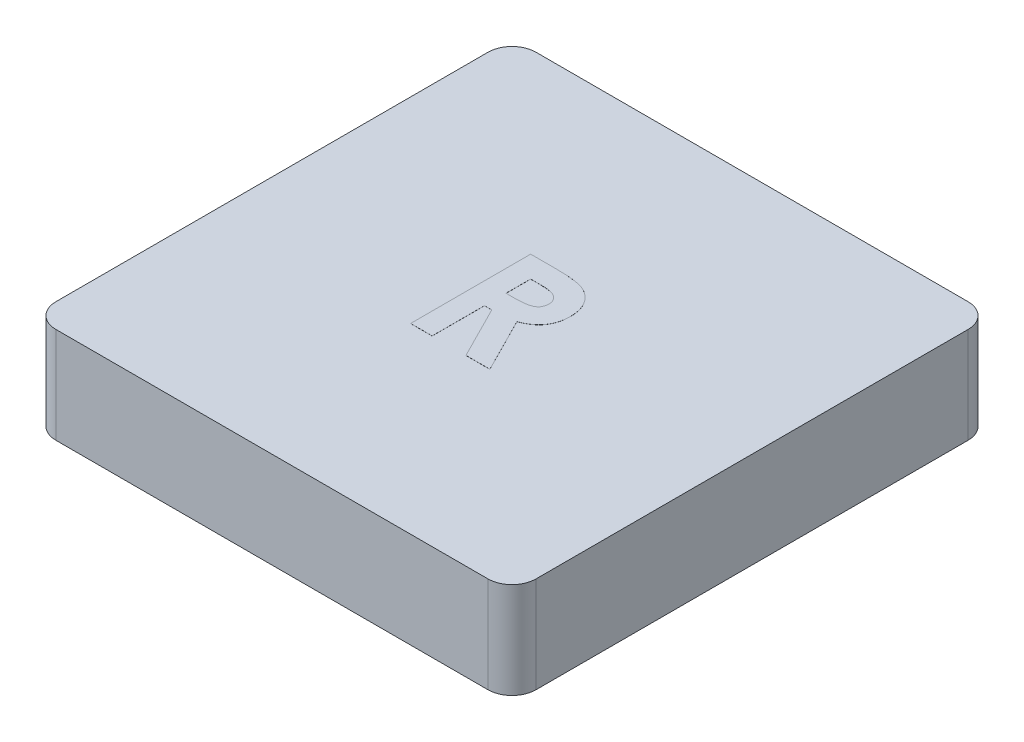
from build123d import *

# Parameters (mm, degrees)
SKETCH1_W           = 12.7
SKETCH1_H           = 12.7
BOSS_EXTRUDE1_DEPTH = 2.54
FILLET1_R           = 0.635
SHELL1_START        = 0.635
SHELL1_OUTLINE_W    = 1.905
SHELL1_OUTLINE_H    = 11.43
SHELL1_DEPTH        = 11.43
SKETCH2_R           = 2.54
BOSS_EXTRUDE2_DEPTH = 1.905
BOSS_EXTRUDE3_DEPTH = 0.00254


# Read off the part's stored shape, not the designer's step: Shell1
with BuildPart() as part:
    # Sketch1 → Boss-Extrude1 (new body)
    with BuildSketch(Plane(origin=(0, 0, 0), x_dir=(1, 0, 0), z_dir=(0, 1, 0))):
        with Locations((6.35, 6.35)):
            Rectangle(SKETCH1_W, SKETCH1_H)
    extrude(amount=BOSS_EXTRUDE1_DEPTH)

    # Fillet1
    fillet1_edges = [part.edges().sort_by_distance(p)[0] for p in [
        (0, 1.27, -12.7),
        (12.7, 1.27, -12.7),
        (12.7, 1.27, 0),
        (0, 1.27, 0),
    ]]
    fillet(fillet1_edges, radius=FILLET1_R)

    # Shell1 outline → Shell1 (cut)
    with BuildSketch(Plane.YZ.offset(SHELL1_START)):
        with Locations((0.9525, -6.35)):
            Rectangle(SHELL1_OUTLINE_W, SHELL1_OUTLINE_H)
    extrude(amount=SHELL1_DEPTH, mode=Mode.SUBTRACT)

    # Sketch2 → Boss-Extrude2 (add)
    with BuildSketch(Plane(origin=(0, 1.905, 0), x_dir=(-1, 0, 0), z_dir=(0, -1, 0))):
        with Locations(Location((-6.35, 6.35, 0), (0, 0, 270))):
            Circle(SKETCH2_R)
    extrude(amount=BOSS_EXTRUDE2_DEPTH)

    # Sketch3 → Boss-Extrude3 (add)
    with BuildSketch(Plane(origin=(0, 2.54, 0), x_dir=(1, 0, 0), z_dir=(0, 1, 0))):
        with BuildLine():
            Line((5.192346154, 8.001), (5.856348558, 8.001))
            add(Edge.make_bspline(
                [(5.856348558, 8.001), (5.900238914, 8.000844214), (5.984652434, 8.000544595), (6.106372118, 7.995817392), (6.218188387, 7.989239101), (6.320266796, 7.979200455), (6.412563672, 7.965890424), (6.49517152, 7.950200099), (6.568087924, 7.93231761), (6.631927834, 7.910034619), (6.689540196, 7.884899742), (6.743242928, 7.856019307), (6.79422079, 7.823714908), (6.842133051, 7.787136528), (6.887396081, 7.746942202), (6.93009527, 7.703091473), (6.969627239, 7.655212502), (7.005747205, 7.603607826), (7.038667646, 7.54932089), (7.067762412, 7.492277157), (7.091422324, 7.432436959), (7.112328392, 7.370665114), (7.127386356, 7.306078583), (7.13785895, 7.239306125), (7.145526573, 7.170112696), (7.145967424, 7.123105753), (7.146192308, 7.099127003)],
                knots=[0, 0, 0, 0, 1.749336639, 3.364467119, 4.854658419, 6.213483162, 7.451590619, 8.570285859, 9.5643256, 10.440900261, 11.26203566, 12.067320669, 12.869050712, 13.665104639, 14.467235401, 15.27997916, 16.102287765, 16.939272006, 17.78853747, 18.631303466, 19.488103222, 20.351255419, 21.228522269, 22.127379805, 23.044756219, 24, 24, 24, 24], degree=3))
            add(Edge.make_bspline(
                [(7.146192308, 7.099127003), (7.145608142, 7.074098697), (7.1444627, 7.025022751), (7.138292723, 6.952934188), (7.127015945, 6.883964894), (7.109935624, 6.818316801), (7.090304013, 6.755172843), (7.064199007, 6.695698066), (7.034736927, 6.639027495), (6.999745675, 6.585962756), (6.961344486, 6.535325176), (6.916684711, 6.489054868), (6.868659617, 6.444664978), (6.814569539, 6.404935939), (6.756798818, 6.367181417), (6.694199611, 6.332965765), (6.627180461, 6.301428881), (6.580062679, 6.283841737), (6.555967949, 6.274848157)],
                knots=[0, 0, 0, 0, 1.099860209, 2.156625411, 3.176576793, 4.16617041, 5.135385252, 6.078461593, 7.016046972, 7.938469504, 8.868247731, 9.803980173, 10.76021508, 11.73834243, 12.748633912, 13.790971185, 14.870363756, 16, 16, 16, 16], degree=3))
            Line((6.555967949, 6.274848157), (7.288660256, 4.826))
            Line((7.288660256, 4.826), (6.655186699, 4.826))
            Line((6.655186699, 4.826), (5.955567308, 6.209974359))
            Line((5.955567308, 6.209974359), (5.762217949, 6.209974359))
            Line((5.762217949, 6.209974359), (5.762217949, 4.826))
            Line((5.762217949, 4.826), (5.192346154, 4.826))
            Line((5.192346154, 4.826), (5.192346154, 8.001))
        make_face()
        with BuildLine():
            Line((5.762217949, 6.779846154), (5.984188101, 6.779846154))
            add(Edge.make_bspline(
                [(5.984188101, 6.779846154), (6.011325797, 6.780151797), (6.063288654, 6.780737037), (6.138018068, 6.783451626), (6.205890197, 6.789992443), (6.267196508, 6.798256521), (6.322245489, 6.807798593), (6.370546122, 6.82147296), (6.412842646, 6.836125392), (6.448633846, 6.854334563), (6.479213025, 6.87504234), (6.505616188, 6.898566889), (6.52745539, 6.92579356), (6.545430168, 6.955982448), (6.55941259, 6.989400567), (6.569618687, 7.025681062), (6.575322386, 7.065237214), (6.575978616, 7.092536345), (6.576320513, 7.106759215)],
                knots=[0, 0, 0, 0, 1.688639943, 3.233382647, 4.650958383, 5.928841754, 7.082724185, 8.122798841, 9.049171256, 9.863274652, 10.613301712, 11.341792392, 12.054588806, 12.776240173, 13.521029143, 14.301969904, 15.115324896, 16, 16, 16, 16], degree=3))
            add(Edge.make_bspline(
                [(6.576320513, 7.106759215), (6.575674126, 7.123585908), (6.57440442, 7.15663883), (6.561804988, 7.204223447), (6.541749414, 7.248266266), (6.514258716, 7.28856829), (6.479637754, 7.323899827), (6.43990747, 7.355044858), (6.394210387, 7.379672018), (6.351898327, 7.39591583), (6.313404242, 7.405634671), (6.278664546, 7.412877065), (6.238435767, 7.418009958), (6.192687537, 7.423454304), (6.14153647, 7.426984687), (6.08470376, 7.429561163), (6.022352631, 7.430615326), (5.978887972, 7.430952323), (5.956203325, 7.431128205)],
                knots=[0, 0, 0, 0, 1.020303359, 2.004196876, 2.966617323, 3.9489082, 4.950758222, 5.960522915, 7.003732012, 8.091992268, 8.70421221, 9.413913587, 10.24622431, 11.166358409, 12.212345909, 13.359657661, 14.621978493, 16, 16, 16, 16], degree=3))
            Line((5.956203325, 7.431128205), (5.762217949, 7.431128205))
            Line((5.762217949, 7.431128205), (5.762217949, 6.779846154))
        make_face(mode=Mode.SUBTRACT)
    extrude(amount=BOSS_EXTRUDE3_DEPTH)


solid = part.part
